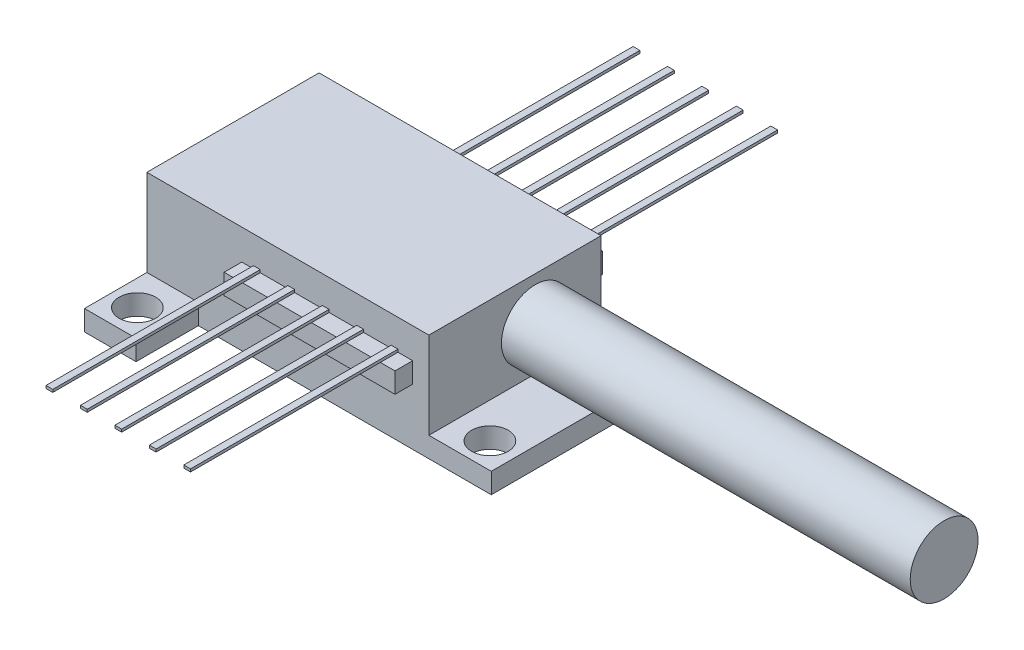
from build123d import *

# Parameters (mm, degrees)
SKETCH1_W               = 20.8
SKETCH1_H               = 12.7
BOSS_EXTRUDE1_DEPTH     = 6.4
BOSS_EXTRUDE2_DEPTH     = 1.5
SKETCH5_R               = 1.35
CUT_EXTRUDE1_DEPTH      = 21.181984541
SKETCH8_R               = 2.5
BOSS_EXTRUDE3_DEPTH     = 30.15
SKETCH9_W               = 12.6
SKETCH9_H               = 1.3
BOSS_EXTRUDE4_DEPTH     = 1.5
SKETCH10_W              = 0.5
SKETCH10_H              = 15.3
BOSS_EXTRUDE5_DEPTH     = 0.2
LPATTERN1_COUNT         = 5
LPATTERN1_PITCH         = 2.54
MIRROR2_COPY_1_SKETCH_W = 0.5
MIRROR2_COPY_1_SKETCH_H = 15.3
MIRROR2_COPY_1_DEPTH    = 0.2
MIRROR2_COPY_2_SKETCH_W = 0.5
MIRROR2_COPY_2_SKETCH_H = 15.3
MIRROR2_COPY_2_DEPTH    = 0.2
MIRROR2_COPY_3_SKETCH_W = 0.5
MIRROR2_COPY_3_SKETCH_H = 15.3
MIRROR2_COPY_3_DEPTH    = 0.2
MIRROR2_COPY_4_SKETCH_W = 0.5
MIRROR2_COPY_4_SKETCH_H = 15.3
MIRROR2_COPY_4_DEPTH    = 0.2


with BuildPart() as part:
    # Sketch1 → Boss-Extrude1 (new body)
    with BuildSketch(Plane(origin=(0, 0, 0), x_dir=(1, 0, 0), z_dir=(0, 1, 0))):
        Rectangle(SKETCH1_W, SKETCH1_H)
    extrude(amount=BOSS_EXTRUDE1_DEPTH)

    # Sketch3 → Boss-Extrude2 (add)
    with BuildSketch(Plane.XZ):
        Polygon((-10.4, 10.95), (-6.6, 10.95), (-6.6, 6.35), (15, 6.35), (15, -6.35), (-6.6, -6.35), (-6.6, -10.95), (-10.4, -10.95), align=None)
    extrude(amount=BOSS_EXTRUDE2_DEPTH)

    # Sketch5 → Cut-Extrude1 (cut, through all)
    with BuildSketch(Plane.XZ.offset(1.5)):
        with Locations((-8.5, 8.95)):
            Circle(SKETCH5_R)
        with Locations((13, 4.45)):
            Circle(SKETCH5_R)
    cut_extrude1 = extrude(amount=-CUT_EXTRUDE1_DEPTH, mode=Mode.SUBTRACT)

    # Mirror3: Cut-Extrude1 across plane
    add(cut_extrude1.mirror(Plane.XY), mode=Mode.SUBTRACT)

    # Sketch8 → Boss-Extrude3 (add)
    with BuildSketch(Plane(origin=(10.4, 0, 0), x_dir=(0, 0, -1), z_dir=(1, 0, 0))):
        with Locations((1.5, 3.2)):
            Circle(SKETCH8_R)
    extrude(amount=BOSS_EXTRUDE3_DEPTH)

    # Sketch9 → Boss-Extrude4 (add)
    with BuildSketch(Plane(origin=(0, 2.665, 0), x_dir=(-1, 0, 0), z_dir=(0, -1, 0))):
        with Locations((-2.9, -7)):
            Rectangle(SKETCH9_W, SKETCH9_H)
    boss_extrude4 = extrude(amount=-BOSS_EXTRUDE4_DEPTH)

    # Sketch10 → Boss-Extrude5 (add)
    with BuildSketch(Plane(origin=(0, 4.165, 0), x_dir=(1, 0, 0), z_dir=(0, 1, 0))):
        with Locations((7.87, -14)):
            Rectangle(SKETCH10_W, SKETCH10_H)
    boss_extrude5 = extrude(amount=BOSS_EXTRUDE5_DEPTH)

    # LPattern1: Boss-Extrude5 ×5
    with Locations(*[(-i * LPATTERN1_PITCH, 0, 0) for i in range(1, LPATTERN1_COUNT)]):
        add(boss_extrude5)

    # Mirror2: Boss-Extrude4, Boss-Extrude5 across plane
    add(boss_extrude4.mirror(Plane.XY))
    add(boss_extrude5.mirror(Plane.XY))

    # Mirror2 copy 1 sketch → Mirror2 copy 1 (add)
    with BuildSketch(Plane(origin=(-2.54, 4.165, 0), x_dir=(1, 0, 0), z_dir=(0, 1, 0))):
        with Locations((7.87, 14)):
            Rectangle(MIRROR2_COPY_1_SKETCH_W, MIRROR2_COPY_1_SKETCH_H)
    extrude(amount=MIRROR2_COPY_1_DEPTH)

    # Mirror2 copy 2 sketch → Mirror2 copy 2 (add)
    with BuildSketch(Plane(origin=(-5.08, 4.165, 0), x_dir=(1, 0, 0), z_dir=(0, 1, 0))):
        with Locations((7.87, 14)):
            Rectangle(MIRROR2_COPY_2_SKETCH_W, MIRROR2_COPY_2_SKETCH_H)
    extrude(amount=MIRROR2_COPY_2_DEPTH)

    # Mirror2 copy 3 sketch → Mirror2 copy 3 (add)
    with BuildSketch(Plane(origin=(-7.62, 4.165, 0), x_dir=(1, 0, 0), z_dir=(0, 1, 0))):
        with Locations((7.87, 14)):
            Rectangle(MIRROR2_COPY_3_SKETCH_W, MIRROR2_COPY_3_SKETCH_H)
    extrude(amount=MIRROR2_COPY_3_DEPTH)

    # Mirror2 copy 4 sketch → Mirror2 copy 4 (add)
    with BuildSketch(Plane(origin=(-10.16, 4.165, 0), x_dir=(1, 0, 0), z_dir=(0, 1, 0))):
        with Locations((7.87, 14)):
            Rectangle(MIRROR2_COPY_4_SKETCH_W, MIRROR2_COPY_4_SKETCH_H)
    extrude(amount=MIRROR2_COPY_4_DEPTH)


solid = part.part
